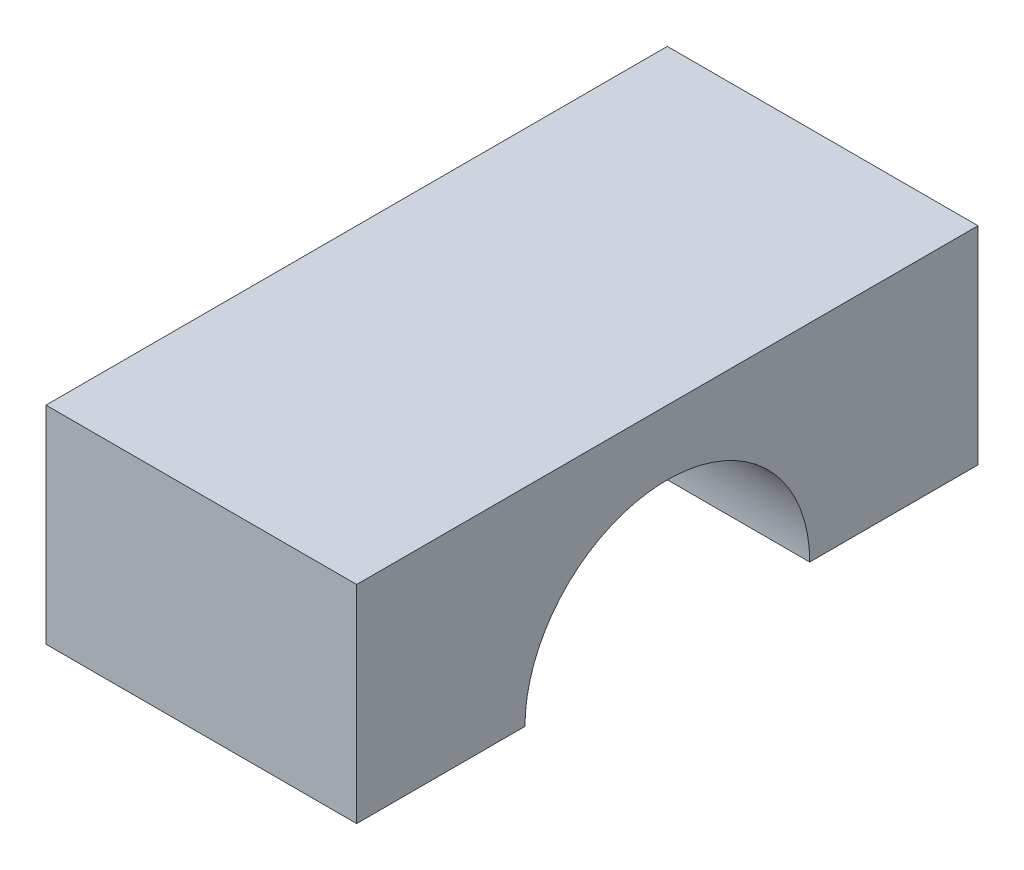
from build123d import *

# Parameters (mm, degrees)
SKETCH1_W           = 76.2
SKETCH1_H           = 25.4
BOSS_EXTRUDE1_DEPTH = 38.1
SKETCH2_R           = 17.4625
CUT_EXTRUDE1_DEPTH  = 89.9


with BuildPart() as part:
    # Sketch1 → Boss-Extrude1 (new body)
    with BuildSketch(Plane(origin=(0, 0, 0), x_dir=(0, 0, -1), z_dir=(1, 0, 0))):
        with Locations((38.1, 12.7)):
            Rectangle(SKETCH1_W, SKETCH1_H)
    extrude(amount=BOSS_EXTRUDE1_DEPTH)

    # Sketch2 → Cut-Extrude1 (cut, through all)
    with BuildSketch(Plane(origin=(38.1, 0, 0), x_dir=(0, 0, -1), z_dir=(1, 0, 0))):
        with Locations((38.1, 0)):
            Circle(SKETCH2_R)
    extrude(amount=-CUT_EXTRUDE1_DEPTH, mode=Mode.SUBTRACT)


solid = part.part
